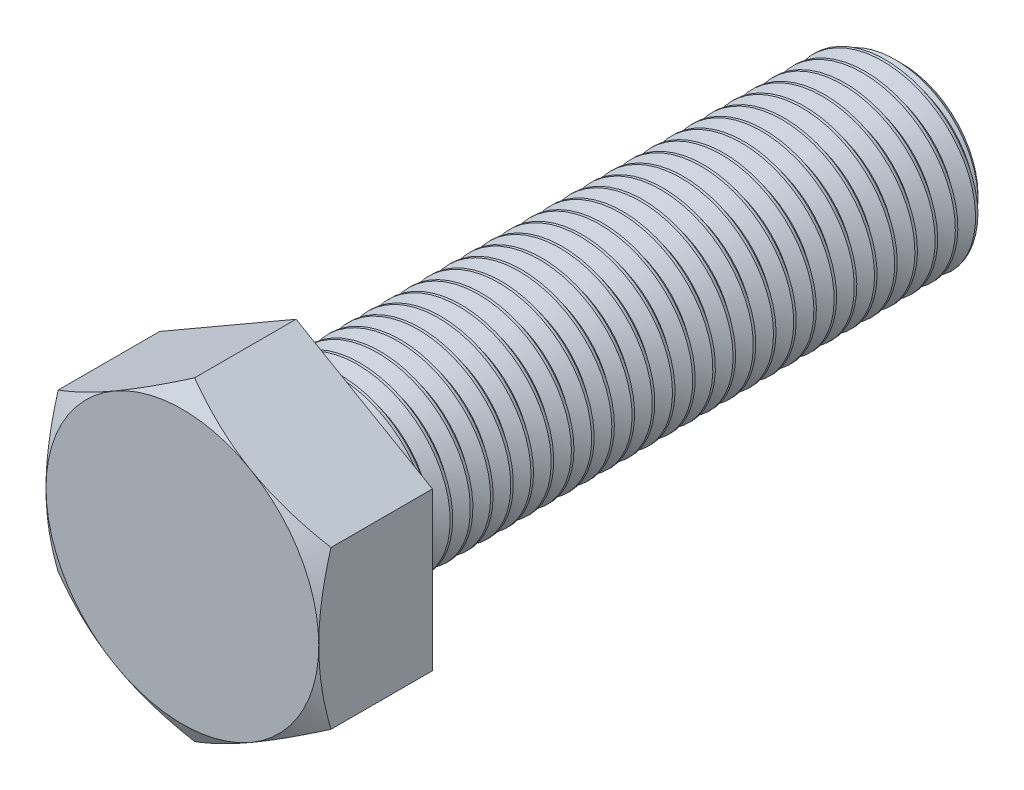
from build123d import *

# Parameters (mm, degrees)
SKETCH2_W           = 31.75
SKETCH2_H           = 4.7625
BOSS_EXTRUDE1_DEPTH = 5.953125
CHAMFER1_SIZE       = 0.79375
SKETCH4_OUTSIDE_W   = 164.432
SKETCH4_OUTSIDE_H   = 166.642
SKETCH4_OUTSIDE_R   = 7.14375
CUT_EXTRUDE1_DEPTH  = 40.250516144
CUT_EXTRUDE1_DRAFT  = -60
CUT_SWEEP1_PITCH    = 1.058333333
CUT_SWEEP1_TO       = 31.75


with BuildPart() as part:
    # Sketch2 → Revolve1 (revolve)
    with BuildSketch(Plane(origin=(0, 0, 0), x_dir=(0, 0, -1), z_dir=(1, 0, 0)), mode=Mode.PRIVATE) as revolve1_sk:
        with Locations((15.875, 2.38125)):
            Rectangle(SKETCH2_W, SKETCH2_H)
    revolve(revolve1_sk.sketch.rotate(Axis((0, 0, 0), (0, 0, -1)), 90), axis=Axis((0, 0, 0), (0, 0, -1)))

    # Sketch3 → Boss-Extrude1 (add)
    with BuildSketch(Plane.XY):
        Polygon((0, 8.248891971), (-7.14375, 4.124445986), (-7.14375, -4.124445986), (0, -8.248891971), (7.14375, -4.124445986), (7.14375, 4.124445986), align=None)
    extrude(amount=BOSS_EXTRUDE1_DEPTH)

    # Chamfer1
    chamfer1_edges = [part.edges().sort_by_distance(p)[0] for p in [
        (-4.7625, 0, -31.75),
    ]]
    chamfer(chamfer1_edges, length=CHAMFER1_SIZE)


with BuildPart() as cut_extrude1_tool:
    # Sketch4 outside → Cut-Extrude1 (with draft: the straight prism first)
    with BuildSketch(Plane.XY.offset(5.953125)):
        Rectangle(SKETCH4_OUTSIDE_W, SKETCH4_OUTSIDE_H)
        Circle(SKETCH4_OUTSIDE_R, mode=Mode.SUBTRACT)
    extrude(amount=-CUT_EXTRUDE1_DEPTH)
    # Cut-Extrude1: the draft: its side faces are tilted about the plane it starts from
    cut_extrude1_sides = [cut_extrude1_tool.faces().sort_by_distance(p)[0] for p in [
        (0, -83.321, -14.172133072),
        (82.216, 0, -14.172133072),
        (0, 83.321, -14.172133072),
        (-82.216, 0, -14.172133072),
        (-7.14375, 0, -14.172133072),
    ]]
    draft(cut_extrude1_sides, Plane.XY.offset(5.953125), CUT_EXTRUDE1_DRAFT)


with BuildPart() as part_1:
    add(part.part)

    # Cut-Extrude1: cut by cut_extrude1_tool
    add(cut_extrude1_tool.part, mode=Mode.SUBTRACT)


with BuildPart() as body_2:
    # Split1: read off the stored shape, not the designer's step
    # Split1: the piece on the far side of the plane
    add(part_1.part)
    split(bisect_by=Plane.XY, keep=Keep.BOTTOM)

    # Cut-Sweep1: arcs per turn and ends read off the stored shape
    # Cut-Sweep1: the profile of Sketch5 screwed along a right-hand helix through 31 turns, 8 arcs to a turn; built about Z, then put on its axis
    cut_sweep1_z = Axis((0, 0, 0), (0, 0, 1))
    cut_sweep1_corners = [(4.819783972, 0, 0.033072917), (4.819783972, 0, -0.959114583), (4.075092336, 0, -0.529166667), (4.075092336, 0, -0.396875)]
    with BuildLine(mode=Mode.PRIVATE) as cut_sweep1_profile:
        Line(cut_sweep1_corners[0], cut_sweep1_corners[1])
        Line(cut_sweep1_corners[1], cut_sweep1_corners[2])
        Line(cut_sweep1_corners[2], cut_sweep1_corners[3])
        Line(cut_sweep1_corners[3], cut_sweep1_corners[0])
    cut_sweep1_cap = Face(cut_sweep1_profile.wire())
    cut_sweep1_turn_angles = [0, 22.5, 45, 67.5, 90, 112.5, 135, 157.5, 180, 202.5, 225, 247.5, 270, 292.5, 315, 337.5, 360]
    cut_sweep1_turn_weights = [1, 0.9238795325112867, 1, 0.9238795325112867, 1, 0.9238795325112867, 1, 0.9238795325112867, 1, 0.9238795325112867, 1, 0.9238795325112867, 1, 0.9238795325112867, 1, 0.9238795325112867, 1]
    cut_sweep1_turn_rails = [Edge.make_bspline([Vector(p[0], p[1], 0).rotate(cut_sweep1_z, cut_sweep1_turn_angles[k]) / cut_sweep1_turn_weights[k] + Vector(0, 0, p[2] + CUT_SWEEP1_PITCH * cut_sweep1_turn_angles[k] / 360) for k in range(17)], [0, 0, 0, 1, 1, 2, 2, 3, 3, 4, 4, 5, 5, 6, 6, 7, 7, 8, 8, 8], 2, cut_sweep1_turn_weights) for p in cut_sweep1_corners]
    cut_sweep1_turn_sides = [Face.make_surface_from_curves(cut_sweep1_turn_rails[p[0]], cut_sweep1_turn_rails[p[1]]) for p in [(0, 1), (1, 2), (2, 3), (3, 0)]]
    cut_sweep1 = Plane(origin=(0, 0, -31.75), x_dir=(0, 1, 0), z_dir=(0, 0, 1)) * split(Solid(Shell([*[p.moved(Location((0, 0, CUT_SWEEP1_PITCH * i))) for i in range(31) for p in cut_sweep1_turn_sides], cut_sweep1_cap, cut_sweep1_cap.rotate(cut_sweep1_z, 11160).moved(Location((0, 0, CUT_SWEEP1_PITCH * 11160 / 360)))])), bisect_by=Plane.XY.offset(CUT_SWEEP1_TO), keep=Keep.BOTTOM, mode=Mode.PRIVATE)
    add(cut_sweep1, mode=Mode.SUBTRACT)


with BuildPart() as part_2:
    add(part_1.part)

    # Split1
    split(bisect_by=Plane.XY, keep=Keep.TOP)

    # Combine1: union body 2
    add(body_2.part)


solid = part_2.part
